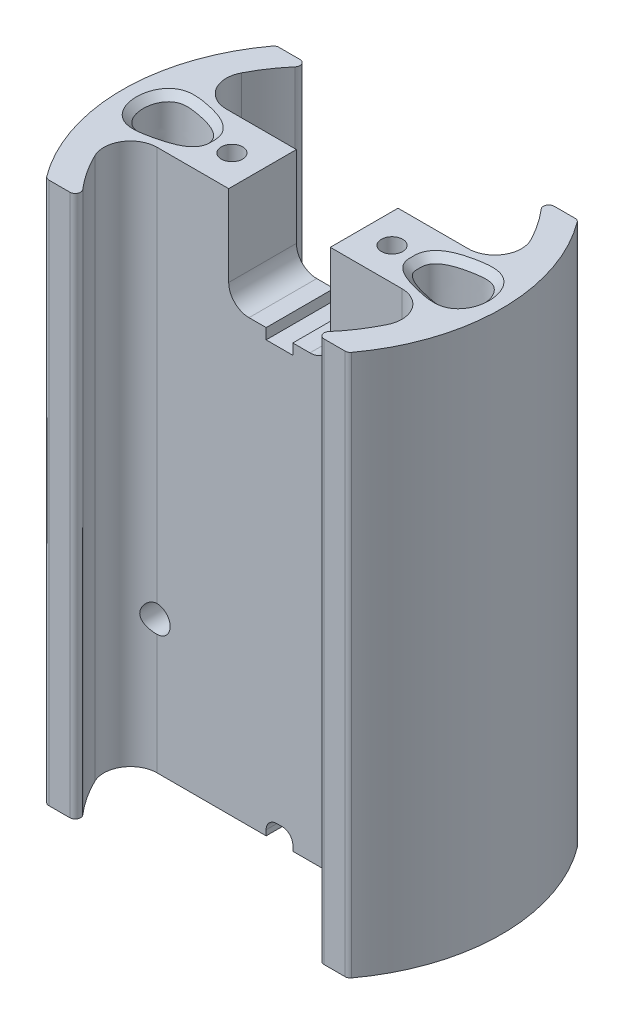
from build123d import *

# Parameters (mm, degrees)
BOSS_EXTRUDE2_DEPTH      = 101.6
FILLET3_R                = 1
FILLET5_R                = 5
SKETCH7_R                = 2
CUT_EXTRUDE2_DEPTH       = 25.4
CHAMFER1_SIZE            = 1.27
EYE_BOLT_HOLE_REACH      = 113.14
SKETCH8_W                = 19.05
SKETCH8_H                = 38.1
FILLET6_R                = 3.81
LIPO_WIRE_HOLE_REACH     = 113.14
SKETCH9_W                = 8
SKETCH9_H                = 14
FILLET8_R                = 2
BOTTO_ZIP_TIE_SLOT_REACH = 113.14
SKETCH10_W               = 5
SKETCH10_H               = 6
FILLET9_R                = 2
SKETCH11_W               = 5
SKETCH11_H               = 13.208
TOP_ZIP_TIE_SLOT_DEPTH   = 2
RX_HOLES_REACH           = 113.268
SKETCH12_R               = 3
CUT_EXTRUDE8_START       = -14
CUT_EXTRUDE8_OUTLINE_R   = 2.5
CUT_EXTRUDE8_DEPTH       = 16


with BuildPart() as part:
    # Sketch2 → Boss-Extrude2 (new body)
    with BuildSketch(Plane(origin=(0, 0, 0), x_dir=(1, 0, 0), z_dir=(0, 1, 0))):
        with BuildLine():
            Line((-21.540573528, -21.56464913), (-28.275068663, -21.56464913))
            ThreePointArc((-28.275068663, -21.56464913), (-35.56, 0), (-28.275068663, 21.56464913))
            Line((-28.275068663, 21.56464913), (-21.540573528, 21.56464913))
            ThreePointArc((-21.540573528, 21.56464913), (-26.716830431, 14.671106698), (-29.7559672, 6.604))
            Line((-29.7559672, 6.604), (29.7559672, 6.604))
            ThreePointArc((29.7559672, 6.604), (26.716830431, 14.671106698), (21.540573528, 21.56464913))
            Line((21.540573528, 21.56464913), (28.275068663, 21.56464913))
            ThreePointArc((28.275068663, 21.56464913), (35.56, 0), (28.275068663, -21.56464913))
            Line((28.275068663, -21.56464913), (21.540573528, -21.56464913))
            ThreePointArc((21.540573528, -21.56464913), (26.840862889, -14.442938737), (29.864178944, -6.096))
            Line((29.864178944, -6.096), (-29.864178944, -6.096))
            ThreePointArc((-29.864178944, -6.096), (-26.840862889, -14.442938737), (-21.540573528, -21.56464913))
        make_face()
    extrude(amount=BOSS_EXTRUDE2_DEPTH)

    # Fillet3
    fillet3_edges = [part.edges().sort_by_distance(p)[0] for p in [
        (21.540573528, 50.8, -21.56464913),
        (28.275068663, 50.8, -21.56464913),
        (28.275068663, 50.8, 21.56464913),
        (21.540573528, 50.8, 21.56464913),
        (-21.540573528, 50.8, 21.56464913),
        (-28.275068663, 50.8, 21.56464913),
        (-28.275068663, 50.8, -21.56464913),
        (-21.540573528, 50.8, -21.56464913),
    ]]
    fillet(fillet3_edges, radius=FILLET3_R)

    # Fillet5
    fillet5_edges = [part.edges().sort_by_distance(p)[0] for p in [
        (29.864178944, 50.8, 6.096),
        (-29.864178944, 50.8, 6.096),
        (-29.7559672, 50.8, -6.604),
        (29.7559672, 50.8, -6.604),
    ]]
    fillet(fillet5_edges, radius=FILLET5_R)

    # Sketch7 → Cut-Extrude2 (cut)
    with BuildSketch(Plane(origin=(0, 101.6, 0), x_dir=(1, 0, 0), z_dir=(0, 1, 0))):
        with Locations(Location((-15.00643914, 0.000327108, 0), (0, 0, 270))):
            Circle(SKETCH7_R)
        with Locations(Location((15.00643914, 0.000327108, 0), (0, 0, 90))):
            Circle(SKETCH7_R)
        with BuildLine():
            add(Edge.make_bspline(
                [(-20, 0.254), (-20.007217652, 1.289693049), (-20.094730358, 3.755585407), (-32.609557916, 5.260011791), (-32.697177082, -5.025488725), (-19.853933448, -2.826485631), (-20.000107918, -0.873041355), (-19.999117199, 0.127323002), (-20, 0.254)],
                knots=[0, 0, 0, 0, 0.320962759, 0.381705376, 0.582346081, 0.646683553, 0.960742617, 1, 1, 1, 1], degree=3))
        make_face()
        with BuildLine():
            add(Edge.make_bspline(
                [(20, 0.254), (20.007217652, 1.289693049), (20.094730358, 3.755585407), (32.609557916, 5.260011791), (32.697177082, -5.025488725), (19.853933448, -2.826485631), (20.000107918, -0.873041355), (19.999117199, 0.127323002), (20, 0.254)],
                knots=[0, 0, 0, 0, 0.320962759, 0.381705376, 0.582346081, 0.646683553, 0.960742617, 1, 1, 1, 1], degree=3))
        make_face()
    extrude(amount=-CUT_EXTRUDE2_DEPTH, mode=Mode.SUBTRACT)

    # Chamfer1
    chamfer1_edges = [part.edges().sort_by_distance(p)[0] for p in [
        (31.81804803, 101.6, -0.17922389),
        (-31.81804803, 101.6, -0.17922389),
    ]]
    chamfer(chamfer1_edges, length=CHAMFER1_SIZE)

    # Sketch8 → Eye bolt hole (cut, up to next)
    with BuildSketch(Plane.XY.offset(6.096), mode=Mode.PRIVATE) as eye_bolt_hole_sk1:
        with Locations((0, 101.6)):
            Rectangle(SKETCH8_W, SKETCH8_H)
    eye_bolt_hole_tool1 = extrude(eye_bolt_hole_sk1.sketch, amount=-EYE_BOLT_HOLE_REACH, mode=Mode.PRIVATE) & part.part
    add(eye_bolt_hole_tool1.solids().sort_by_distance((0, 101.6, 6.096))[0], mode=Mode.SUBTRACT)

    # Fillet6
    fillet6_edges = [part.edges().sort_by_distance(p)[0] for p in [
        (9.525, 82.55, -0.254),
        (-9.525, 82.55, -0.254),
    ]]
    fillet(fillet6_edges, radius=FILLET6_R)

    # Sketch9 → LiPo wire hole (cut, up to next)
    with BuildSketch(Plane.XY.offset(6.096), mode=Mode.PRIVATE) as lipo_wire_hole_sk1:
        with Locations((12.587070083, 0)):
            Rectangle(SKETCH9_W, SKETCH9_H)
    lipo_wire_hole_tool1 = extrude(lipo_wire_hole_sk1.sketch, amount=-LIPO_WIRE_HOLE_REACH, mode=Mode.PRIVATE) & part.part
    add(lipo_wire_hole_tool1.solids().sort_by_distance((12.58707, 0, 6.096))[0], mode=Mode.SUBTRACT)

    # Fillet8
    fillet8_edges = [part.edges().sort_by_distance(p)[0] for p in [
        (16.587070083, 7, -0.254),
        (8.587070083, 7, -0.254),
    ]]
    fillet(fillet8_edges, radius=FILLET8_R)

    # Sketch10 → Botto zip tie slot (cut, up to next)
    with BuildSketch(Plane.XY.offset(6.096), mode=Mode.PRIVATE) as botto_zip_tie_slot_sk1:
        Rectangle(SKETCH10_W, SKETCH10_H)
    botto_zip_tie_slot_tool1 = extrude(botto_zip_tie_slot_sk1.sketch, amount=-BOTTO_ZIP_TIE_SLOT_REACH, mode=Mode.PRIVATE) & part.part
    add(botto_zip_tie_slot_tool1.solids().sort_by_distance((0, 0, 6.096))[0], mode=Mode.SUBTRACT)

    # Fillet9
    fillet9_edges = [part.edges().sort_by_distance(p)[0] for p in [
        (2.5, 3, -0.254),
        (-2.5, 3, -0.254),
    ]]
    fillet(fillet9_edges, radius=FILLET9_R)

    # Sketch11 → Top zip tie slot (cut)
    with BuildSketch(Plane(origin=(0, 82.55, 0), x_dir=(1, 0, 0), z_dir=(0, 1, 0))):
        Rectangle(SKETCH11_W, SKETCH11_H)
    extrude(amount=-TOP_ZIP_TIE_SLOT_DEPTH, mode=Mode.SUBTRACT)

    # Sketch12 → RX holes (cut, up to next)
    with BuildSketch(Plane(origin=(0, 0, -6.604), x_dir=(-1, 0, 0), z_dir=(0, 0, -1)), mode=Mode.PRIVATE) as rx_holes_sk1:
        with Locations((-16.476798817, 69.6)):
            Circle(SKETCH12_R)
    rx_holes_tool1 = extrude(rx_holes_sk1.sketch, amount=-RX_HOLES_REACH, mode=Mode.PRIVATE) & part.part
    # Sketch12 → RX holes (cut, up to next)
    with BuildSketch(Plane(origin=(0, 0, -6.604), x_dir=(-1, 0, 0), z_dir=(0, 0, -1)), mode=Mode.PRIVATE) as rx_holes_sk2:
        with Locations((-16.878340595, 55.605759606)):
            Circle(SKETCH12_R)
    rx_holes_tool2 = extrude(rx_holes_sk2.sketch, amount=-RX_HOLES_REACH, mode=Mode.PRIVATE) & part.part
    add(rx_holes_tool1.solids().sort_by_distance((16.476799, 69.6, -6.604))[0], mode=Mode.SUBTRACT)
    add(rx_holes_tool2.solids().sort_by_distance((16.878341, 55.60576, -6.604))[0], mode=Mode.SUBTRACT)

    # Cut-Extrude8: read off the stored shape, not the designer's step
    # Cut-Extrude8 outline → Cut-Extrude8 (cut)
    with BuildSketch(Plane(origin=(0, 0, -6.604), x_dir=(-1, 0, 0), z_dir=(0, 0, -1)).offset(CUT_EXTRUDE8_START)):
        with Locations((23, 25)):
            Circle(CUT_EXTRUDE8_OUTLINE_R)
        with Locations((-23, 25)):
            Circle(CUT_EXTRUDE8_OUTLINE_R)
    extrude(amount=CUT_EXTRUDE8_DEPTH, mode=Mode.SUBTRACT)


solid = part.part
